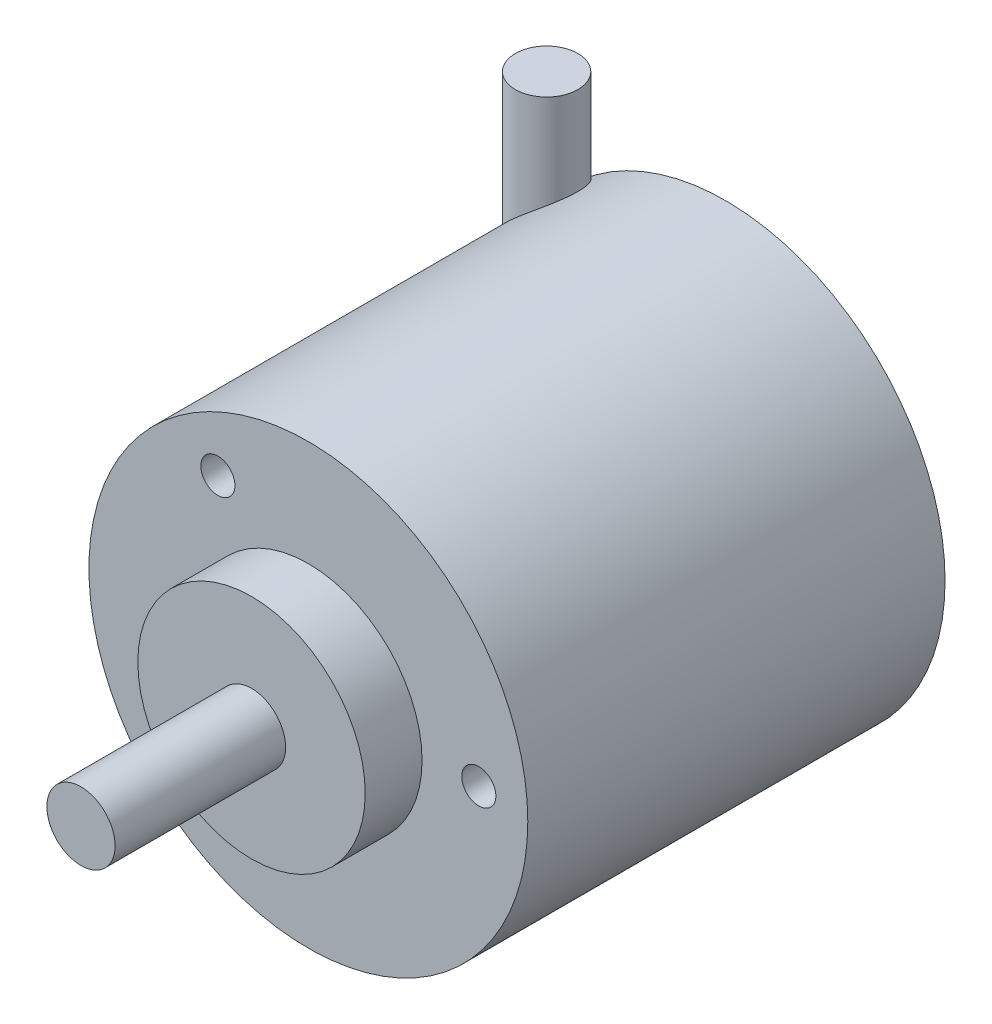
from build123d import *

# Parameters (mm, degrees)
SKETCH1_R           = 19.3
BOSS_EXTRUDE1_DEPTH = 36.7
SKETCH3_R           = 10
BOSS_EXTRUDE2_DEPTH = 5
SKETCH4_R           = 3
BOSS_EXTRUDE3_DEPTH = 15
SKETCH8_R           = 2.75
BOSS_EXTRUDE4_DEPTH = 15
SKETCH9_R           = 2.75
BOSS_EXTRUDE5_DEPTH = 5
SKETCH5_R           = 1.5
CUT_EXTRUDE1_DEPTH  = 10


with BuildPart() as part:
    # Sketch1 → Boss-Extrude1 (new body)
    with BuildSketch(Plane.XY):
        with Locations((-14.127422454, 5.37928778)):
            Circle(SKETCH1_R)
    extrude(amount=BOSS_EXTRUDE1_DEPTH)

    # Sketch3 → Boss-Extrude2 (add)
    with BuildSketch(Plane.XY.offset(36.7)):
        with Locations((-14.127422454, 5.37928778)):
            Circle(SKETCH3_R)
    extrude(amount=BOSS_EXTRUDE2_DEPTH)

    # Sketch4 → Boss-Extrude3 (add)
    with BuildSketch(Plane.XY.offset(41.7)):
        with Locations((-14.127422454, 5.37928778)):
            Circle(SKETCH4_R)
    extrude(amount=BOSS_EXTRUDE3_DEPTH)



with BuildPart() as body_2:
    # Sketch8 → Boss-Extrude4 (new body)
    with BuildSketch(Plane(origin=(0, 24.67928778, 0), x_dir=(1, 0, 0), z_dir=(0, 1, 0))):
        with Locations((-26.832117877, -3.04260895)):
            Circle(SKETCH8_R)
    extrude(amount=-BOSS_EXTRUDE4_DEPTH)


with BuildPart() as part_1:
    add(part.part)

    add(body_2.part)  # Boss-Extrude5 merges body 2
    # Sketch9 → Boss-Extrude5 (add)
    with BuildSketch(Plane(origin=(0, 24.67928778, 0), x_dir=(1, 0, 0), z_dir=(0, 1, 0))):
        with Locations((-26.832117877, -3.04260895)):
            Circle(SKETCH9_R)
    extrude(amount=BOSS_EXTRUDE5_DEPTH)

    # Sketch5 → Cut-Extrude1 (cut)
    with BuildSketch(Plane.XY.offset(36.7)):
        with Locations((0.862954929, 5.91648973)):
            Circle(SKETCH5_R)
        with Locations((-21.15738061, -7.87136082)):
            Circle(SKETCH5_R)
        with Locations((-22.08784168, 18.092734431)):
            Circle(SKETCH5_R)
    extrude(amount=-CUT_EXTRUDE1_DEPTH, mode=Mode.SUBTRACT)


solid = part_1.part
